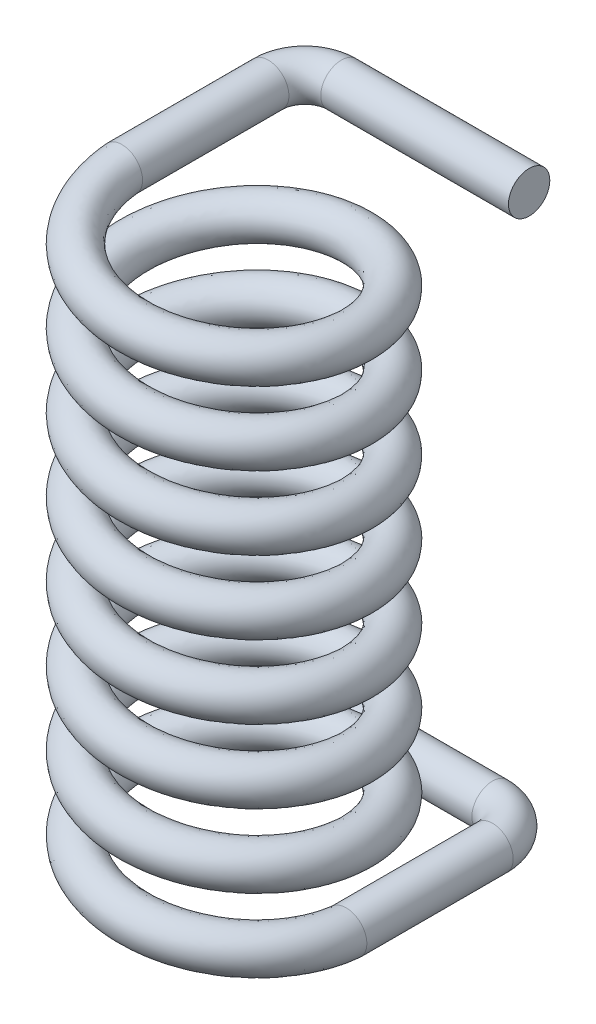
from build123d import *

# Parameters (mm, degrees)
SWEEP1_PITCH       = 4
SWEEP1_HEIGHT      = 30
SWEEP1_RADIUS      = 6.13
SWEEP1_START_ANGLE = 90
SKETCH1_R          = 1.13
SKETCH1_3_R        = 1.13
SWEEP3_OUTLINE_R   = 1.13
SWEEP3_ANGLE       = 90
SWEEP3_START       = -8.0000001
SWEEP3_2_OUTLINE_R = 1.13
SWEEP3_2_DEPTH     = 8.0000001
SWEEP3_START_2     = -4.1300001
SWEEP3_3_OUTLINE_R = 1.13
SWEEP3_3_DEPTH     = 10.2600001


with BuildPart() as part:
    # Sweep1: sweep along a helix
    with BuildLine() as sweep1_path:
        add(Helix(SWEEP1_PITCH, SWEEP1_HEIGHT, SWEEP1_RADIUS, center=(0, 0, 0), direction=(0, 1, 0), lefthand=True, mode=Mode.PRIVATE).rotate(Axis((0, 0, 0), (0, 1, 0)), SWEEP1_START_ANGLE))
    # Sketch1 → Sweep1 (sweep)
    with BuildSketch(Plane.XY):
        with Locations((6.13, 0)):
            Circle(SKETCH1_R)
    sweep(path=sweep1_path.line, is_frenet=True)

    # Sweep2: sweep along a path in Sketch3
    with BuildLine(Plane(origin=(0, 0, 0), x_dir=(1, 0, 0), z_dir=(0, 1, 0))) as sweep2_path:
        Line((6.13, 0), (6.13, 8))
        ThreePointArc((6.13, 8), (5.544213562, 9.414213562), (4.13, 10))
        Line((4.13, 10), (-6.13, 10))
    # Sketch1<3> → Sweep2 (sweep)
    with BuildSketch(Plane.XY):
        with Locations((6.13, 0)):
            Circle(SKETCH1_3_R)
    sweep(path=sweep2_path.line)



with BuildPart() as body_2:
    # Sweep3: read off the stored shape, not the designer's step
    # Sweep3 outline → Sweep3 (revolve)
    with BuildSketch(Plane(origin=(-4.13, 0, -8), x_dir=(0, 0, -1), z_dir=(1, 0, 0))):
        with Locations((2, 30)):
            Circle(SWEEP3_OUTLINE_R)
    revolve(axis=Axis((-4.13, 0, -8), (0, 1, 0)), revolution_arc=SWEEP3_ANGLE)


with BuildPart() as part_1:
    add(part.part)

    add(body_2.part)  # Sweep3 2 merges body 2
    # Sweep3 2 outline → Sweep3 2 (add)
    with BuildSketch(Plane.XY.offset(SWEEP3_START)):
        with Locations((-6.13, 30)):
            Circle(SWEEP3_2_OUTLINE_R)
    extrude(amount=SWEEP3_2_DEPTH)

    # Sweep3 3 outline → Sweep3 3 (add)
    with BuildSketch(Plane.YZ.offset(SWEEP3_START_2)):
        with Locations((30, -10)):
            Circle(SWEEP3_3_OUTLINE_R)
    extrude(amount=SWEEP3_3_DEPTH)


solid = part_1.part
